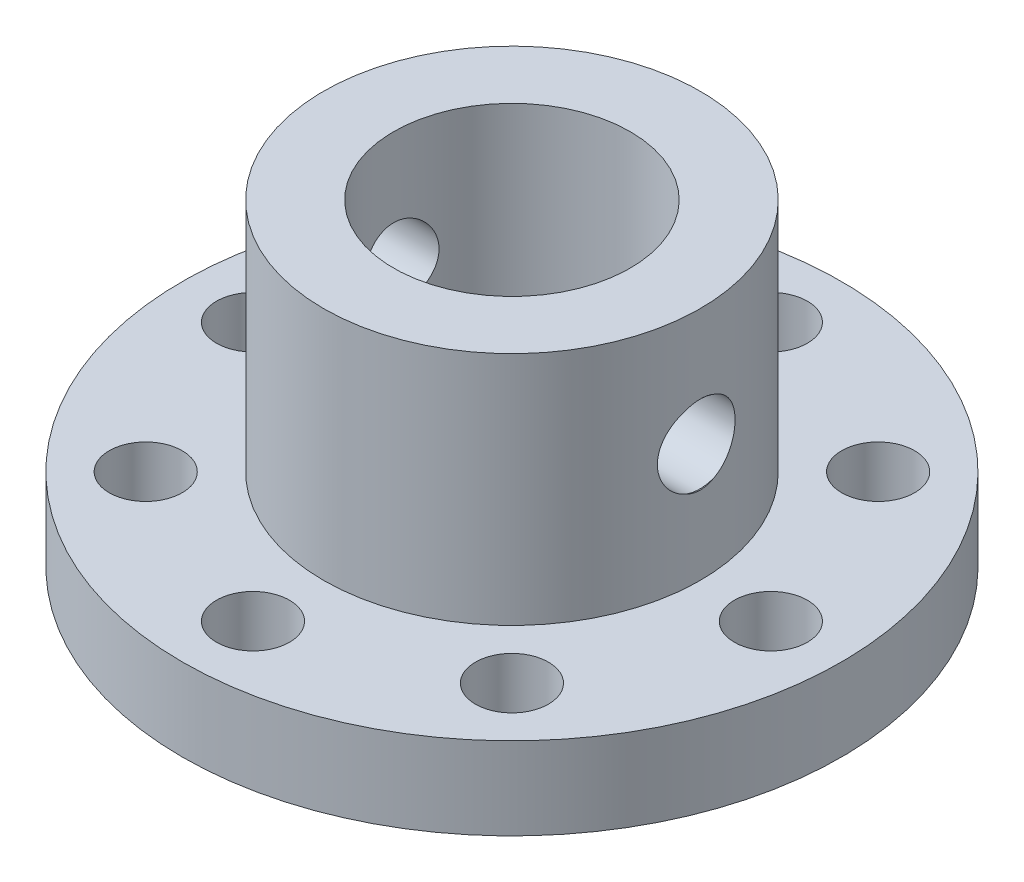
from build123d import *

# Parameters (mm, degrees)
SKETCH1_R                             = 14
BOSS_EXTRUDE1_DEPTH                   = 1.75
M2_5_CLEARANCE_HOLE1_D                = 3.1
M2_5_CLEARANCE_HOLE1_DEPTH            = 6
M2_5_CLEARANCE_HOLE1_TIP              = 0.931333959
SKETCH9_R                             = 8
BOSS_EXTRUDE2_DEPTH                   = 10
SKETCH7_R                             = 5.025
CUT_EXTRUDE1_DEPTH                    = 24.963513933
TAP_DRILL_FOR_M4X0_7_TAP2_D           = 3.3
TAP_DRILL_FOR_M4X0_7_TAP2_DEPTH       = 25.4
TAP_DRILL_FOR_M4X0_7_TAP2_CSINK_D     = 3.35
TAP_DRILL_FOR_M4X0_7_TAP2_CSINK_ANGLE = 90
TAP_DRILL_FOR_M4X0_7_TAP2_TIP         = 0.991420021


with BuildPart() as part:
    # Sketch1 → Boss-Extrude1 (new, symmetric)
    with BuildSketch(Plane(origin=(0, 0, 0), x_dir=(1, 0, 0), z_dir=(0, 1, 0))):
        Circle(SKETCH1_R)
    extrude(amount=BOSS_EXTRUDE1_DEPTH, both=True)

    # M2.5 Clearance Hole1
    with Locations(Plane(origin=(0, 1.75, 0), x_dir=(1, 0, 0), z_dir=(0, 1, 0))):
        with Locations((-11, 0), (-7.778174593, 7.778174593), (0, 11), (7.778174593, 7.778174593), (11, 0), (7.778174593, -7.778174593), (0, -11), (-7.778174593, -7.778174593)):
            Hole(M2_5_CLEARANCE_HOLE1_D / 2, depth=M2_5_CLEARANCE_HOLE1_DEPTH)
            with Locations((0, 0, -(M2_5_CLEARANCE_HOLE1_DEPTH + M2_5_CLEARANCE_HOLE1_TIP / 2))):  # 118° drill point
                Cone(0, M2_5_CLEARANCE_HOLE1_D / 2, M2_5_CLEARANCE_HOLE1_TIP, mode=Mode.SUBTRACT)

    # Sketch9 → Boss-Extrude2 (add)
    with BuildSketch(Plane(origin=(0, 1.75, 0), x_dir=(1, 0, 0), z_dir=(0, 1, 0))):
        Circle(SKETCH9_R)
    extrude(amount=BOSS_EXTRUDE2_DEPTH)

    # Sketch7 → Cut-Extrude1 (cut, through all)
    with BuildSketch(Plane.XZ.offset(1.75)):
        Circle(SKETCH7_R)
    extrude(amount=-CUT_EXTRUDE1_DEPTH, mode=Mode.SUBTRACT)

    # Tap Drill for M4x0.7 Tap2
    with Locations(Plane(origin=(8, 0, 0), x_dir=(0, 0, -1), z_dir=(1, 0, 0))):
        with Locations((0, 6.75)):
            CounterSinkHole(TAP_DRILL_FOR_M4X0_7_TAP2_D / 2, TAP_DRILL_FOR_M4X0_7_TAP2_CSINK_D / 2, depth=TAP_DRILL_FOR_M4X0_7_TAP2_DEPTH, counter_sink_angle=TAP_DRILL_FOR_M4X0_7_TAP2_CSINK_ANGLE)
            with Locations((0, 0, -(TAP_DRILL_FOR_M4X0_7_TAP2_DEPTH + TAP_DRILL_FOR_M4X0_7_TAP2_TIP / 2))):  # 118° drill point
                Cone(0, TAP_DRILL_FOR_M4X0_7_TAP2_D / 2, TAP_DRILL_FOR_M4X0_7_TAP2_TIP, mode=Mode.SUBTRACT)


solid = part.part
